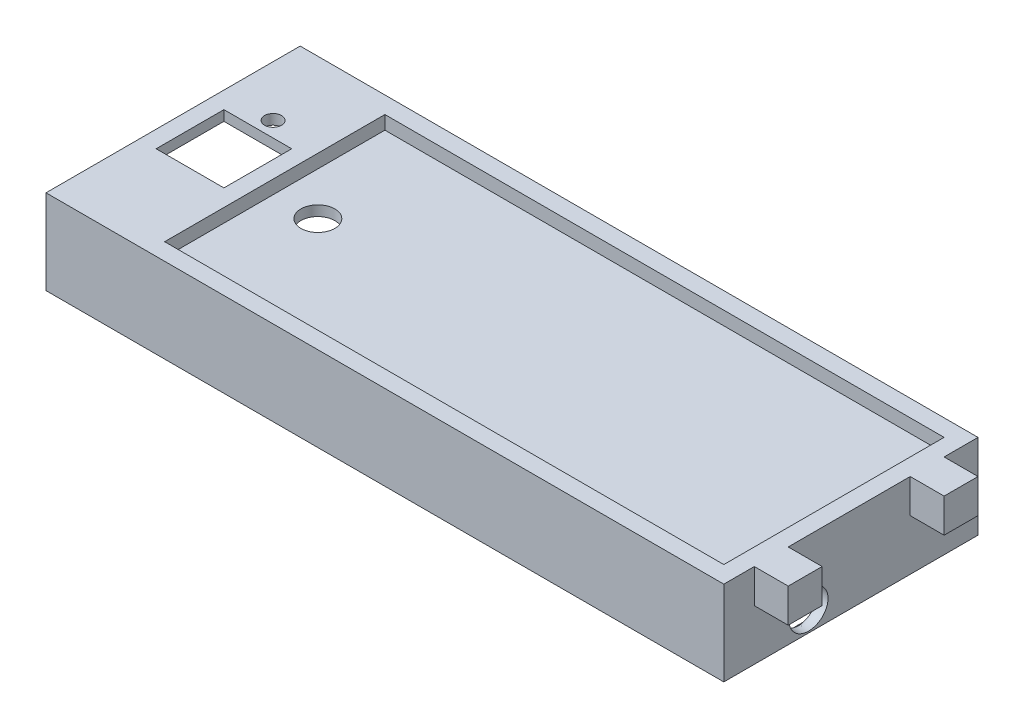
from build123d import *

# Parameters (mm, degrees)
SKETCH1_W           = 200
SKETCH1_H           = 75
BOSS_EXTRUDE1_DEPTH = 25
SKETCH9_W           = 165
SKETCH9_H           = 65
CUT_EXTRUDE5_DEPTH  = 4
SHELL3_START        = -34.5
SHELL3_DEPTH        = 69
SKETCH14_W          = 10
SKETCH14_H          = 10
BOSS_EXTRUDE5_DEPTH = 10
SKETCH15_R          = 5
CUT_EXTRUDE7_DEPTH  = 157.036053526
SKETCH16_W          = 20
SKETCH16_H          = 20
CUT_EXTRUDE8_DEPTH  = 157.624551077
SKETCH19_RX         = 5.75
SKETCH19_RY         = 5.5
SKETCH21_R          = 2.5
CUT_EXTRUDE9_DEPTH  = 157.624551117


# Read off the part's stored shape, not the designer's step: Shell3
with BuildPart() as part:
    # Sketch1 → Boss-Extrude1 (new body)
    with BuildSketch(Plane(origin=(0, 0, 0), x_dir=(1, 0, 0), z_dir=(0, 1, 0))):
        with Locations((40, 0)):
            Rectangle(SKETCH1_W, SKETCH1_H)
    extrude(amount=BOSS_EXTRUDE1_DEPTH)

    # Sketch9 → Cut-Extrude5 (cut)
    with BuildSketch(Plane(origin=(0, 25, 0), x_dir=(1, 0, 0), z_dir=(0, 1, 0))):
        with Locations((52.5, 0)):
            Rectangle(SKETCH9_W, SKETCH9_H)
    extrude(amount=-CUT_EXTRUDE5_DEPTH, mode=Mode.SUBTRACT)

    # Shell3 outline → Shell3 (cut)
    with BuildSketch(Plane.XY.offset(SHELL3_START)):
        Polygon((137, 0), (137, 18), (-33, 18), (-33, 22), (-60, 22), (-60, 0), align=None)
    extrude(amount=SHELL3_DEPTH, mode=Mode.SUBTRACT)

    # Sketch14 → Boss-Extrude5 (add)
    with BuildSketch(Plane(origin=(140, 0, 0), x_dir=(0, 0, -1), z_dir=(1, 0, 0))):
        with Locations((-23.5, 20)):
            Rectangle(SKETCH14_W, SKETCH14_H)
        with Locations((22.5, 20)):
            Rectangle(SKETCH14_W, SKETCH14_H)
    extrude(amount=BOSS_EXTRUDE5_DEPTH)

    # Sketch15 → Cut-Extrude7 (cut, through all)
    with BuildSketch(Plane(origin=(0, 21, 0), x_dir=(1, 0, 0), z_dir=(0, 1, 0))):
        with Locations(Location((-17.28231035, 0, 0), (0, 0, 270))):
            Circle(SKETCH15_R)
    extrude(amount=-CUT_EXTRUDE7_DEPTH, mode=Mode.SUBTRACT)

    # Sketch16 → Cut-Extrude8 (cut, through all)
    with BuildSketch(Plane(origin=(0, 25, 0), x_dir=(1, 0, 0), z_dir=(0, 1, 0))):
        with Locations((-45, 0)):
            Rectangle(SKETCH16_W, SKETCH16_H)
    extrude(amount=-CUT_EXTRUDE8_DEPTH, mode=Mode.SUBTRACT)

    # Cut-Sweep2: sweep along a path in Sketch20
    with BuildLine() as cut_sweep2_path:  # in the path sketch's own coordinates; laid on its plane below (add() does not lay a ready-made edge on the line's plane)
        add(Edge.make_bspline(
            [(-140, 6), (-136.19888528, 6.630281352), (-133.075750061, 4.182881523)],
            knots=[0, 0, 0, 1, 1, 1], degree=2))
    # Sketch19 → Cut-Sweep2 (sweep, cut)
    with BuildSketch(Plane(origin=(140, 0, 0), x_dir=(0, 0, -1), z_dir=(1, 0, 0))):
        with Locations(Location((-12.5, 6), (0, 0, 0))):
            Ellipse(SKETCH19_RX, SKETCH19_RY)
    sweep(path=Plane(origin=(0, 0, 0), x_dir=(-1, 0, 0), z_dir=(0, 0, -1)) * cut_sweep2_path.line, mode=Mode.SUBTRACT)

    # Sketch21 → Cut-Extrude9 (cut, through all)
    with BuildSketch(Plane(origin=(0, 25, 0), x_dir=(1, 0, 0), z_dir=(0, 1, 0))):
        with Locations(Location((-45, 14.5, 0), (0, 0, 270))):
            Circle(SKETCH21_R)
    extrude(amount=-CUT_EXTRUDE9_DEPTH, mode=Mode.SUBTRACT)


solid = part.part
